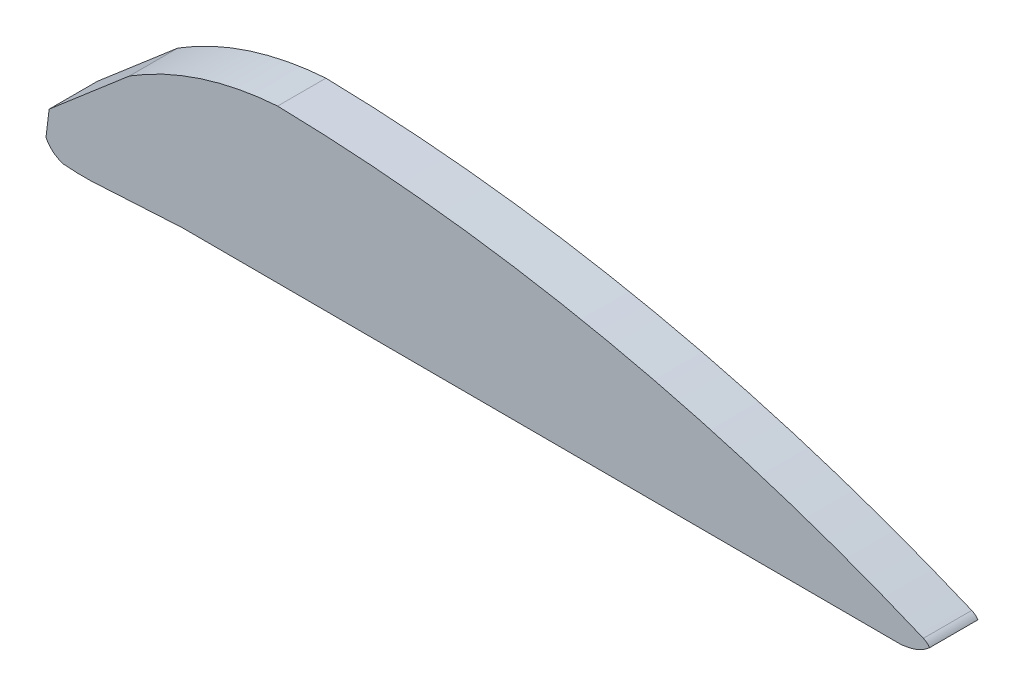
from build123d import *

# Parameters (mm, degrees)
TABAN_FLAN_1_DEPTH = 35


# Sheet-metal steps are written as plain solids
with BuildPart() as part:
    # Çizim1 → Taban-Flanş1 (new body)
    with BuildSketch(Plane.XY):
        with BuildLine():
            Line((619.494818874, -8.424828485), (98.926807278, -7.251557341))
            Line((98.926807278, -7.251557341), (43.504425744, -10.354452253))
            ThreePointArc((43.504425744, -10.354452253), (28.028820782, -11.029931963), (12.553215819, -10.354452253))
            ThreePointArc((12.553215819, -10.354452253), (5.187207724, -6.497959982), (0, 0))
            Line((0, 0), (2.280792838, 18.926510932))
            Line((2.280792838, 18.926510932), (60.45793545, 68.809534856))
            ThreePointArc((60.45793545, 68.809534856), (111.943036833, 92.83857175), (167.737234585, 103.567866957))
            ThreePointArc((167.737234585, 103.567866957), (406.337705204, 75.758628342), (635.459190458, 3.599891337))
            ThreePointArc((635.459190458, 3.599891337), (637.974703815, 2.109119279), (640, 0))
            ThreePointArc((640, 0), (632.566042161, -5.006768243), (623.989844607, -7.610667804))
            ThreePointArc((623.989844607, -7.610667804), (621.750134496, -8.060827589), (619.494818874, -8.424828485))
        make_face()
    extrude(amount=TABAN_FLAN_1_DEPTH)


solid = part.part
